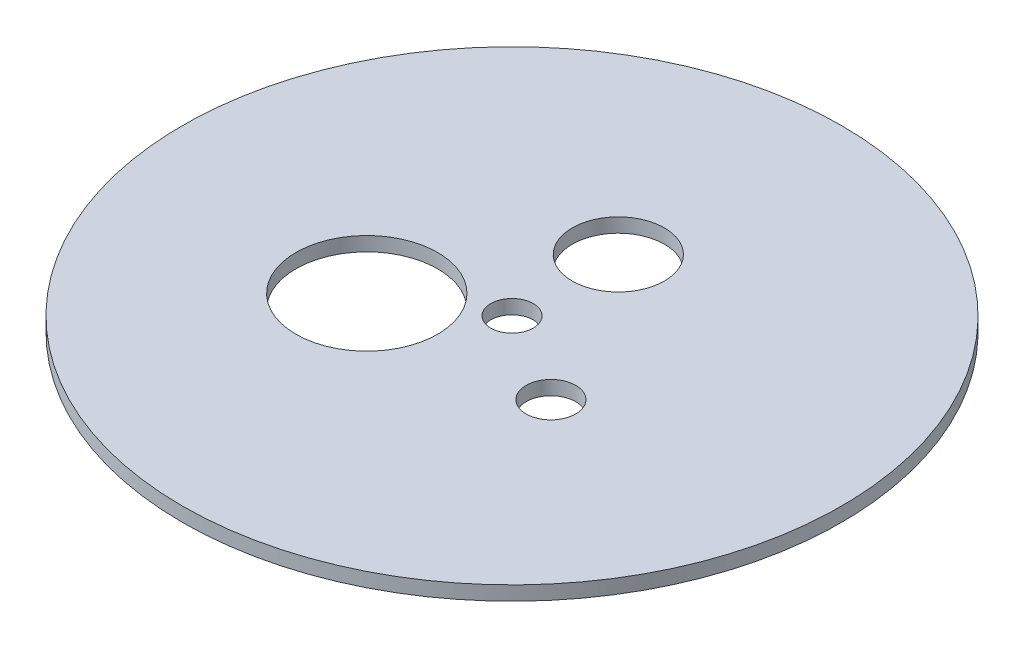
from build123d import *

# Parameters (mm, degrees)
SKETCH1_R           = 46.5
SKETCH1_R_2         = 6.5
SKETCH1_R_3         = 10
SKETCH1_R_4         = 3.5
SKETCH1_R_5         = 3
BOSS_EXTRUDE1_DEPTH = 2


with BuildPart() as part:
    # Sketch1 → Boss-Extrude1 (new body)
    with BuildSketch(Plane(origin=(0, 0, 0), x_dir=(1, 0, 0), z_dir=(0, 1, 0))):
        Circle(SKETCH1_R)
        with Locations((0, 15)):
            Circle(SKETCH1_R_2, mode=Mode.SUBTRACT)
        with Locations((-12.990381057, -7.5)):
            Circle(SKETCH1_R_3, mode=Mode.SUBTRACT)
        with Locations((12.990381057, -7.5)):
            Circle(SKETCH1_R_4, mode=Mode.SUBTRACT)
        Circle(SKETCH1_R_5, mode=Mode.SUBTRACT)
    extrude(amount=BOSS_EXTRUDE1_DEPTH)


solid = part.part
